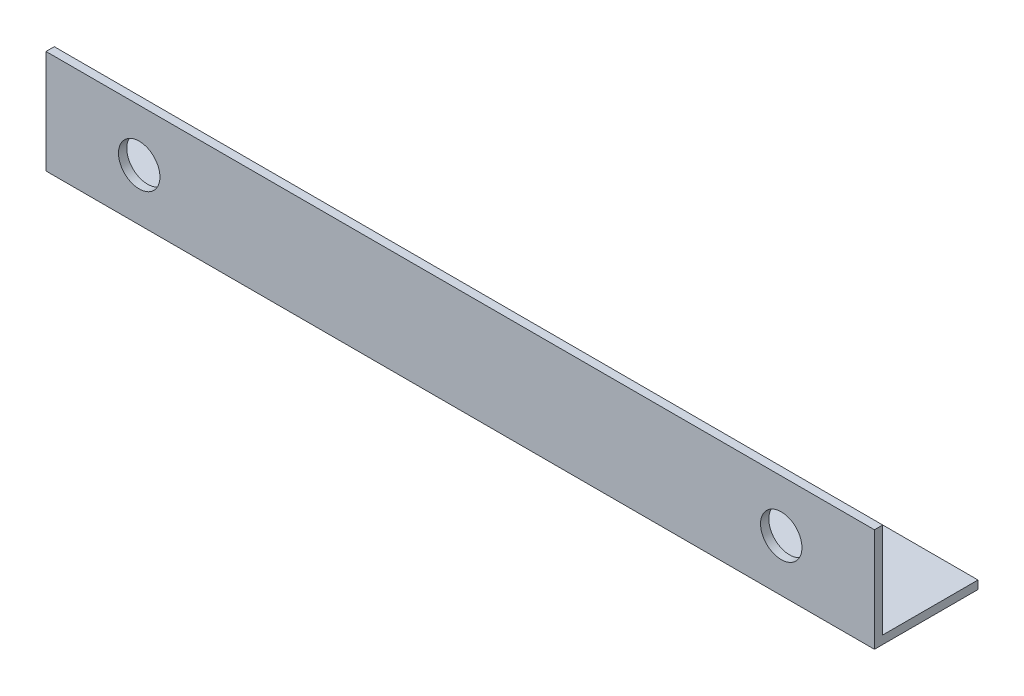
from build123d import *

# Parameters (mm, degrees)
EXTRUDE_1_DEPTH     = 200
SKETCH_2_R          = 5
CUT_EXTRUDE_1_DEPTH = 204.100960116


with BuildPart() as part:
    # Эскиз1 → Вытянуть-Тонкостенный1 (new body)
    with BuildSketch(Plane(origin=(0, 0, 0), x_dir=(0, 0, -1), z_dir=(1, 0, 0))):
        Polygon((0, 25), (0, 0), (25, 0), (25, 2), (2, 2), (2, 25), align=None)
    extrude(amount=EXTRUDE_1_DEPTH)

    # Эскиз2 → Вырез-Вытянуть1 (cut, through all)
    with BuildSketch(Plane.XY):
        with Locations((22.5, 12.5)):
            Circle(SKETCH_2_R)
        with Locations((177.5, 12.5)):
            Circle(SKETCH_2_R)
    extrude(amount=-CUT_EXTRUDE_1_DEPTH, mode=Mode.SUBTRACT)


solid = part.part
